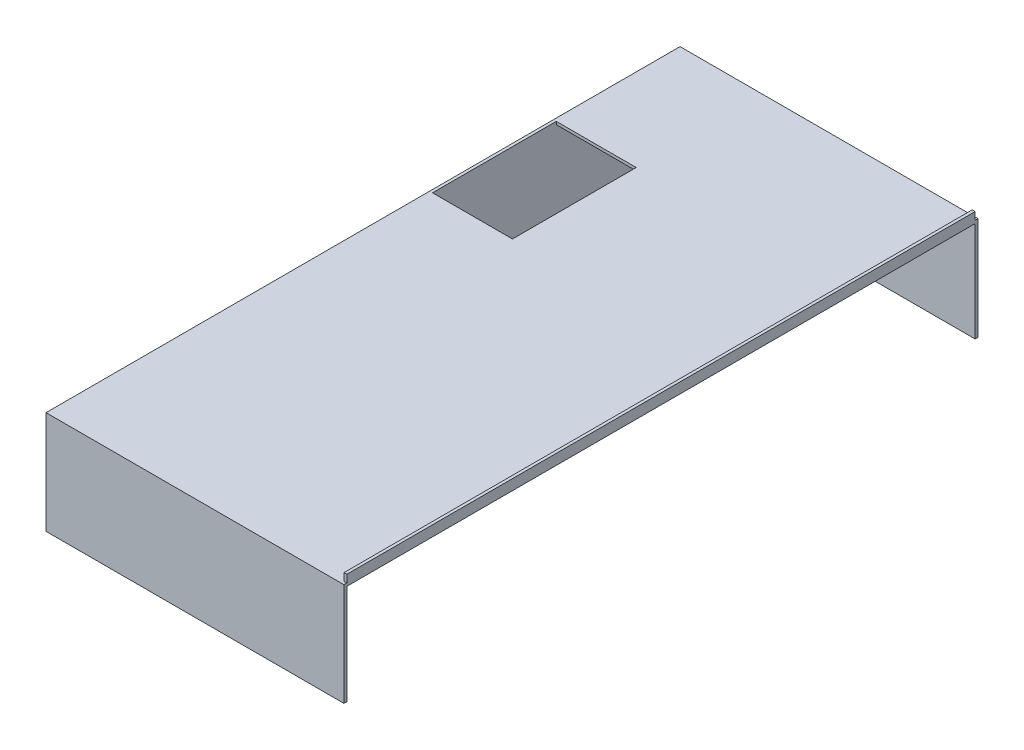
from build123d import *

# Parameters (mm, degrees)
BOSS_EXTRUDE4_DEPTH  = 1.5
SKETCH5_W            = 155
SKETCH5_H            = 54
BOSS_EXTRUDE5_DEPTH  = 1.5
SKETCH8_W            = 1.5
SKETCH8_H            = 330
BOSS_EXTRUDE14_DEPTH = 4
SKETCH7_W            = 155
SKETCH7_H            = 54
BOSS_EXTRUDE18_DEPTH = 1.5
SKETCH9_W            = 333
SKETCH9_H            = 54
BOSS_EXTRUDE19_DEPTH = 1.5


with BuildPart() as part:
    # Sketch4 → Boss-Extrude4 (new body)
    with BuildSketch(Plane(origin=(0, 0, 0), x_dir=(1, 0, 0), z_dir=(0, 1, 0))):
        Polygon((179.47837592, 330), (334.47837592, 330), (334.47837592, 0), (179.47837592, 0), (179.47837592, 200), (221.47837592, 200), (221.47837592, 265), (179.47837592, 265), align=None)
    extrude(amount=BOSS_EXTRUDE4_DEPTH)

    # Sketch5 → Boss-Extrude5 (add)
    with BuildSketch(Plane.XY):
        with Locations((256.97837592, -25.5)):
            Rectangle(SKETCH5_W, SKETCH5_H)
    extrude(amount=BOSS_EXTRUDE5_DEPTH)

    # Sketch8 → Boss-Extrude14 (add)
    with BuildSketch(Plane(origin=(0, 1.5, 0), x_dir=(1, 0, 0), z_dir=(0, 1, 0))):
        with Locations((333.72837592, 165)):
            Rectangle(SKETCH8_W, SKETCH8_H)
    extrude(amount=BOSS_EXTRUDE14_DEPTH)

    # Sketch7 → Boss-Extrude18 (add)
    with BuildSketch(Plane(origin=(0, 0, -330), x_dir=(-1, 0, 0), z_dir=(0, 0, -1))):
        with Locations((-256.97837592, -25.5)):
            Rectangle(SKETCH7_W, SKETCH7_H)
    extrude(amount=BOSS_EXTRUDE18_DEPTH)

    # Sketch9 → Boss-Extrude19 (add)
    with BuildSketch(Plane.ZY.offset(-179.47837592)):
        with Locations((-165, -25.5)):
            Rectangle(SKETCH9_W, SKETCH9_H)
    extrude(amount=BOSS_EXTRUDE19_DEPTH)


solid = part.part
